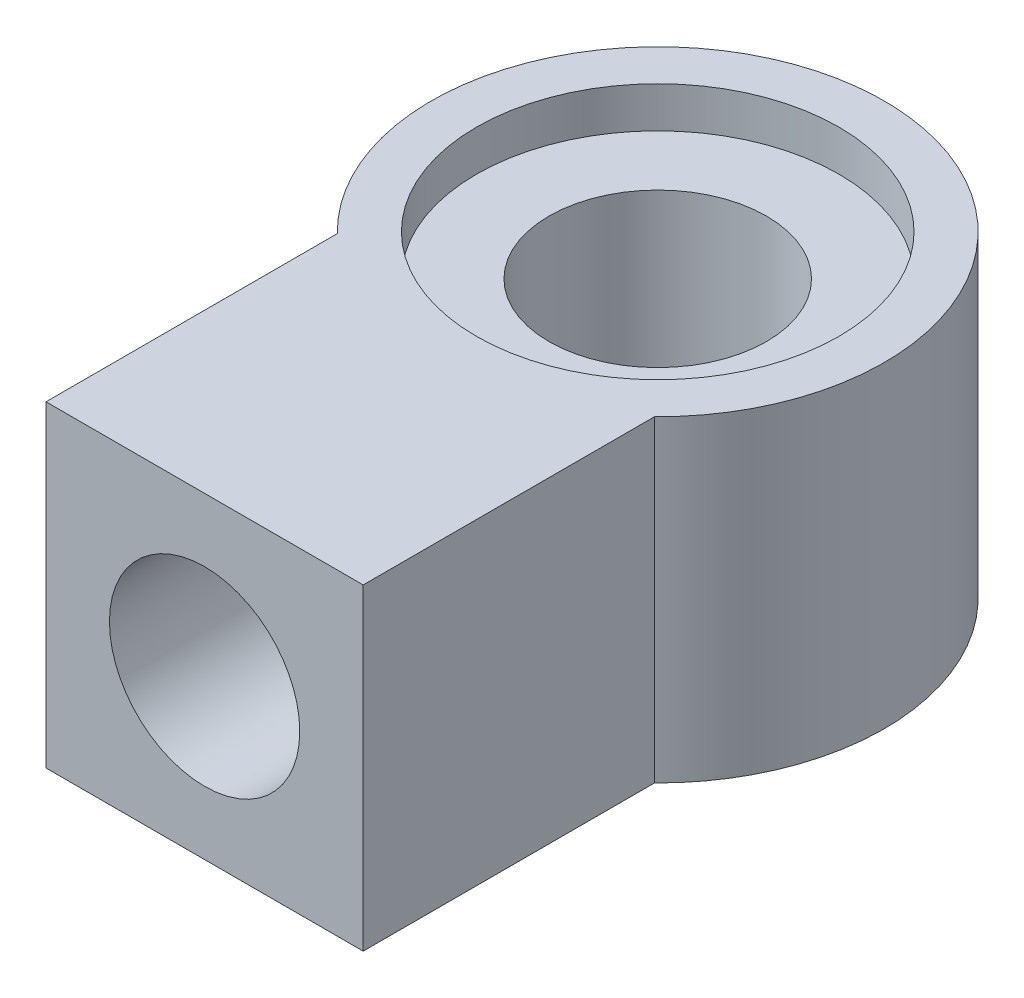
from build123d import *

# Parameters (mm, degrees)
SKETCH1_R           = 5
SKETCH1_R_2         = 2.4
BOSS_EXTRUDE1_DEPTH = 7
SKETCH2_W           = 7
SKETCH2_H           = 7
BOSS_EXTRUDE3_DEPTH = 1.5
SKETCH4_W           = 7
SKETCH4_H           = 7
SKETCH4_R           = 2.1
BOSS_EXTRUDE4_DEPTH = 5
SKETCH5_R           = 4
CUT_EXTRUDE1_DEPTH  = 0.9


with BuildPart() as part:
    # Sketch1 → Boss-Extrude1 (new body)
    with BuildSketch(Plane(origin=(0, 0, 0), x_dir=(1, 0, 0), z_dir=(0, 1, 0))):
        Circle(SKETCH1_R)
        Circle(SKETCH1_R_2, mode=Mode.SUBTRACT)
    extrude(amount=BOSS_EXTRUDE1_DEPTH)

    # Sketch2 → Boss-Extrude3 (add)
    with BuildSketch(Plane.XY.offset(5)):
        with Locations((0, 3.5)):
            Rectangle(SKETCH2_W, SKETCH2_H)
    extrude(amount=-BOSS_EXTRUDE3_DEPTH)

    # Sketch4 → Boss-Extrude4 (add)
    with BuildSketch(Plane.XY.offset(5)):
        with Locations((0, 3.5)):
            Rectangle(SKETCH4_W, SKETCH4_H)
        with Locations((0, 3.5)):
            Circle(SKETCH4_R, mode=Mode.SUBTRACT)
    extrude(amount=BOSS_EXTRUDE4_DEPTH)

    # Sketch5 → Cut-Extrude1 (cut)
    with BuildSketch(Plane(origin=(0, 7, 0), x_dir=(1, 0, 0), z_dir=(0, 1, 0))):
        Circle(SKETCH5_R)
    extrude(amount=-CUT_EXTRUDE1_DEPTH, mode=Mode.SUBTRACT)


solid = part.part
